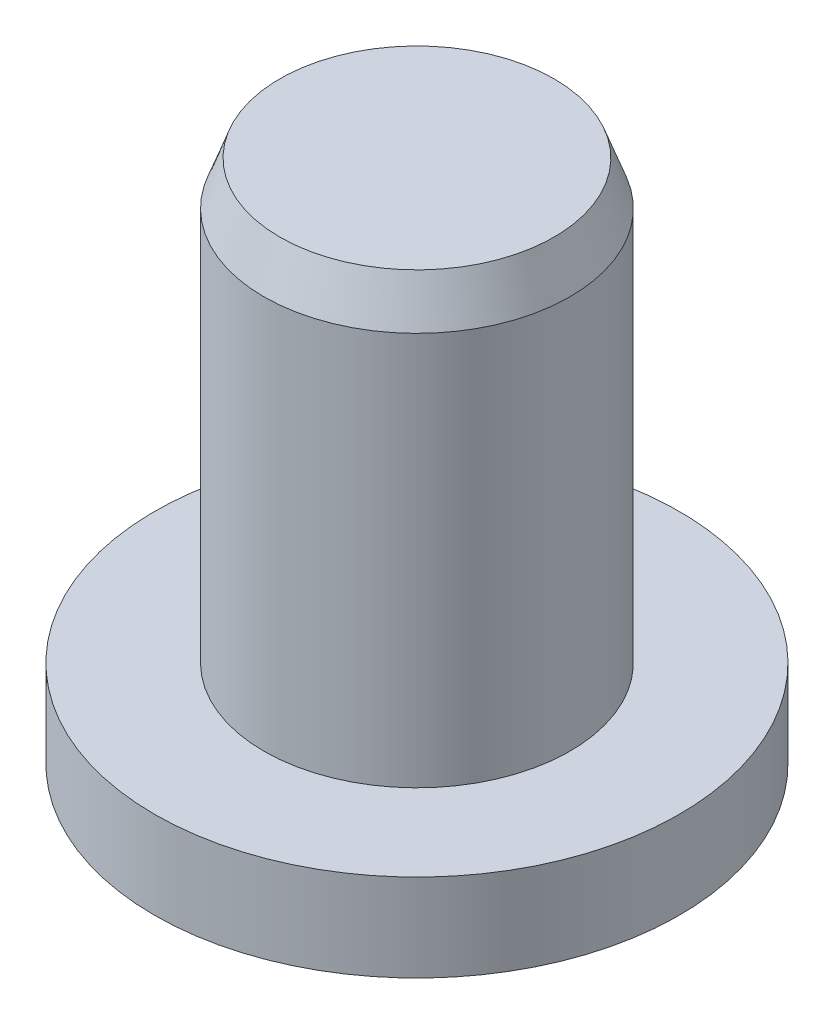
from build123d import *

# Parameters (mm, degrees)
SKETCH1_R           = 6
BOSS_EXTRUDE1_DEPTH = 2
SKETCH2_R           = 3.5
BOSS_EXTRUDE2_DEPTH = 10
CHAMFER1_SIZE       = 1
CHAMFER1_SIZE2      = 0.363970234


with BuildPart() as part:
    # Sketch1 → Boss-Extrude1 (new body)
    with BuildSketch(Plane(origin=(0, 0, 0), x_dir=(1, 0, 0), z_dir=(0, 1, 0))):
        Circle(SKETCH1_R)
    extrude(amount=BOSS_EXTRUDE1_DEPTH)

    # Sketch2 → Boss-Extrude2 (add)
    with BuildSketch(Plane(origin=(0, 2, 0), x_dir=(1, 0, 0), z_dir=(0, 1, 0))):
        Circle(SKETCH2_R)
    extrude(amount=BOSS_EXTRUDE2_DEPTH)

    # Chamfer1
    chamfer1_edges = [part.edges().sort_by_distance(p)[0] for p in [
        (-3.5, 12, 0),
    ]]
    chamfer1_side = [part.faces().sort_by_distance(p)[0] for p in [
        (-3.5, 7, 0),
    ]]
    chamfer(chamfer1_edges, length=CHAMFER1_SIZE, length2=CHAMFER1_SIZE2, reference=chamfer1_side[0])


solid = part.part
